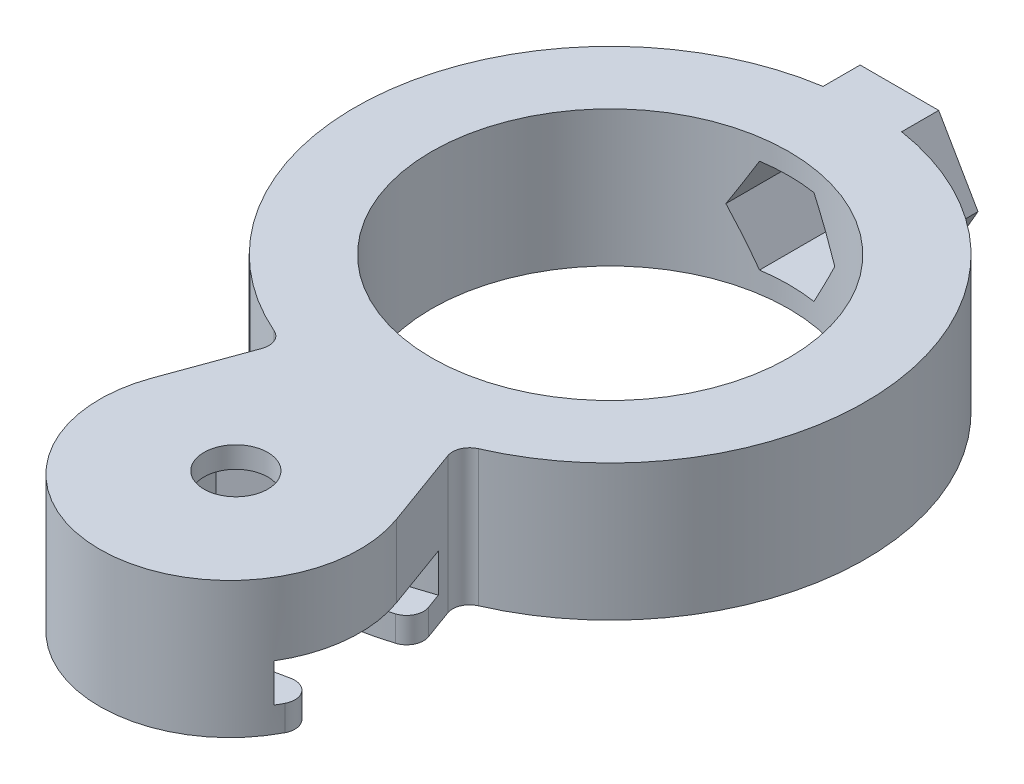
from build123d import *
from build123d.topology import SkipClean

# Parameters (mm, degrees)
CROQUIS1_R                          = 15
CROQUIS1_R_2                        = 10.5
SALIENTE_EXTRUIR1_DEPTH             = 4
CROQUIS2_R                          = 1.875
CORTAR_EXTRUIR1_DEPTH               = 8
SALIENTE_EXTRUIR2_REACH             = 35.779
SALIENTE_EXTRUIR2_END_RADIUS        = 15
CROQUIS2_4_R                        = 1.875
SALIENTE_EXTRUIR2_DIRECTION_2_DEPTH = 2
REVOLUCI_N1_ANGLE                   = 20
REVOLUCI_N1_OTHER_WAY_ANGLE         = 20
CORTAR_EXTRUIR6_DEPTH               = 35.481879299
CORTAR_EXTRUIR6_DEPTH_BACK          = 3
CROQUIS4_3_R                        = 1.875
CORTAR_EXTRUIR7_DEPTH               = 35.481879299
CORTAR_EXTRUIR8_START               = -8
CORTAR_EXTRUIR8_DEPTH               = 8
REDONDEO3_R                         = 1
SALIENTE_EXTRUIR3_START             = 5
SALIENTE_EXTRUIR3_DEPTH             = 5
CORTAR_EXTRUIR9_DEPTH               = 1.75
CORTAR_EXTRUIR9_DEPTH_BACK          = 0.5
SALIENTE_EXTRUIR4_OUTLINE_R         = 1.875
SALIENTE_EXTRUIR4_DEPTH             = 2.75
CORTAR_EXTRUIR10_DEPTH              = 3


# Read off the part's stored shape, not the designer's step: Cortar-Extruir8, Saliente-Extruir4
with BuildPart() as part:
    # Croquis1 → Saliente-Extruir1 (new, symmetric)
    with BuildSketch(Plane(origin=(0, 0, 0), x_dir=(1, 0, 0), z_dir=(0, 1, 0))):
        with Locations(Location((0, 0, 0), (0, 0, 270))):
            Circle(CROQUIS1_R)
        with Locations(Location((0, 0, 0), (0, 0, 270))):
            Circle(CROQUIS1_R_2, mode=Mode.SUBTRACT)
    extrude(amount=SALIENTE_EXTRUIR1_DEPTH, both=True)

    # Croquis2 → Cortar-Extruir1 (cut)
    with BuildSketch(Plane(origin=(0, 0, -15), x_dir=(-1, 0, 0), z_dir=(0, 0, -1))):
        Polygon((-3.2, 0), (-1.6, -2.771281292), (1.6, -2.771281292), (3.2, 0), (1.6, 2.771281292), (-1.6, 2.771281292), align=None)
        Circle(CROQUIS2_R)
    extrude(amount=-CORTAR_EXTRUIR1_DEPTH, mode=Mode.SUBTRACT)

    # Saliente-Extruir2: up to this cylinder (the profile starts outside it)
    with SkipClean():  # the faces are left unmerged after this step: merging them gives an invalid solid
        saliente_extruir2_end = Plane(origin=(0, -1.641104, 0), z_dir=(0, -1, 0)) * Cylinder(SALIENTE_EXTRUIR2_END_RADIUS, 103.15359, mode=Mode.PRIVATE)
        # Croquis2<4> → Saliente-Extruir2 (add, up to the surface)
        with BuildSketch(Plane(origin=(0, 0, -15), x_dir=(-1, 0, 0), z_dir=(0, 0, -1)), mode=Mode.PRIVATE) as saliente_extruir2_sk1:
            Polygon((-4.618802154, 0), (-2.309401077, -4), (2.309401077, -4), (4.618802154, 0), (2.309401077, 4), (-2.309401077, 4), align=None)
            Polygon((-1.6, -2.771281292), (1.6, -2.771281292), (3.2, 0), (1.6, 2.771281292), (-1.6, 2.771281292), (-3.2, 0), align=None, mode=Mode.SUBTRACT)
        saliente_extruir2_tool1 = extrude(saliente_extruir2_sk1.sketch, amount=-SALIENTE_EXTRUIR2_REACH, mode=Mode.PRIVATE) - saliente_extruir2_end
        add(saliente_extruir2_tool1.solids().sort_by_distance((3.358272, -1.938899, -15))[0])
        add(saliente_extruir2_tool1.solids().sort_by_distance((3.358272, -1.938899, -15))[1])
        # Croquis2<4> → Saliente-Extruir2 (add, up to the surface)
        with BuildSketch(Plane(origin=(0, 0, -15), x_dir=(-1, 0, 0), z_dir=(0, 0, -1)), mode=Mode.PRIVATE) as saliente_extruir2_sk2:
            Polygon((-3.2, 0), (-1.6, -2.771281292), (1.6, -2.771281292), (3.2, 0), (1.6, 2.771281292), (-1.6, 2.771281292), align=None)
            Circle(CROQUIS2_4_R, mode=Mode.SUBTRACT)
        saliente_extruir2_tool2 = extrude(saliente_extruir2_sk2.sketch, amount=-SALIENTE_EXTRUIR2_REACH, mode=Mode.PRIVATE) - saliente_extruir2_end
        add(saliente_extruir2_tool2.solids().sort_by_distance((2.326679, -1.343309, -15))[0])
        add(saliente_extruir2_tool2.solids().sort_by_distance((2.326679, -1.343309, -15))[1])

    # Croquis2<4> → Saliente-Extruir2 direction 2 (add)
    # profile 1 of 2: a face of its own
    with BuildSketch(Plane(origin=(0, 0, -15), x_dir=(-1, 0, 0), z_dir=(0, 0, -1))):
        Polygon((-4.618802154, 0), (-2.309401077, -4), (2.309401077, -4), (4.618802154, 0), (2.309401077, 4), (-2.309401077, 4), align=None)
        Polygon((-1.6, -2.771281292), (1.6, -2.771281292), (3.2, 0), (1.6, 2.771281292), (-1.6, 2.771281292), (-3.2, 0), align=None, mode=Mode.SUBTRACT)
    # profile 2 of 2: a face of its own
    with BuildSketch(Plane(origin=(0, 0, -15), x_dir=(-1, 0, 0), z_dir=(0, 0, -1))):
        Polygon((-3.2, 0), (-1.6, -2.771281292), (1.6, -2.771281292), (3.2, 0), (1.6, 2.771281292), (-1.6, 2.771281292), align=None)
        Circle(CROQUIS2_4_R, mode=Mode.SUBTRACT)
    extrude(amount=SALIENTE_EXTRUIR2_DIRECTION_2_DEPTH)

    # Croquis3 → Revolución1 (revolve)
    with BuildSketch(Plane(origin=(0, 0, 0), x_dir=(0, 0, -1), z_dir=(1, 0, 0))):
        Polygon((-30, 4), (-14, 4), (-14, -4), (-30, -4), (-30, -2.5), (-15, -2.5), (-15, 2.5), (-30, 2.5), align=None)
    revolve(axis=Axis((0, 4, 0), (0, -1, 0)), revolution_arc=REVOLUCI_N1_ANGLE)

    # Croquis3 → Revolución1 other way (revolve)
    with BuildSketch(Plane(origin=(0, 0, 0), x_dir=(0, 0, -1), z_dir=(1, 0, 0))):
        Polygon((-30, 4), (-14, 4), (-14, -4), (-30, -4), (-30, -2.5), (-15, -2.5), (-15, 2.5), (-30, 2.5), align=None)
    revolve(axis=Axis((0, 4, 0), (0, 1, 0)), revolution_arc=REVOLUCI_N1_OTHER_WAY_ANGLE)

    # Croquis4 → Cortar-Extruir6 (cut, two sides: drawn at the far end of the back side and taken through both)
    with BuildSketch(Plane.XZ.offset(4).offset(-CORTAR_EXTRUIR6_DEPTH_BACK)):
        with BuildLine():
            ThreePointArc((8.584705597, 23.586284782), (4.358569265, 24.7186746), (1.2e-08, 25.1))
            ThreePointArc((1.2e-08, 25.1), (-3.1, 22.000000006), (0, 18.9))
            ThreePointArc((0, 18.9), (3.281950558, 18.612866532), (6.464180709, 17.760190533))
            Line((6.464180709, 17.760190533), (8.584705597, 23.586284782))
        make_face()
    extrude(amount=CORTAR_EXTRUIR6_DEPTH + CORTAR_EXTRUIR6_DEPTH_BACK, mode=Mode.SUBTRACT)

    # Croquis4<3> → Cortar-Extruir7 (cut, through all)
    with BuildSketch(Plane.XZ.offset(4)):
        with Locations(Location((0, 22, 0), (0, 0, 270))):
            Circle(CROQUIS4_3_R)
    extrude(amount=-CORTAR_EXTRUIR7_DEPTH, mode=Mode.SUBTRACT)

    # Cortar-Extruir8 outline → Cortar-Extruir8 (cut)
    with BuildSketch(Plane.XZ.offset(4).offset(CORTAR_EXTRUIR8_START)):
        with BuildLine():
            ThreePointArc((-7.184552477, 19.7393957), (-6.262942497, 26.739718497), (1e-09, 30))
            ThreePointArc((1e-09, 30), (-5.20944533, 29.544232591), (-10.2606043, 28.190778624))
            Line((-10.2606043, 28.190778624), (-7.184552477, 19.7393957))
        make_face()
        with BuildLine():
            Line((7.184552477, 19.7393957), (8.584705598, 23.586284782))
            Line((8.584705598, 23.586284782), (10.2606043, 28.190778624))
            ThreePointArc((10.2606043, 28.190778624), (5.209445331, 29.54423259), (1e-09, 30))
            ThreePointArc((1e-09, 30), (6.262942498, 26.739718496), (7.184552477, 19.7393957))
        make_face()
    extrude(amount=CORTAR_EXTRUIR8_DEPTH, mode=Mode.SUBTRACT)

    # Redondeo3
    redondeo3_edges = [part.edges().sort_by_distance(p)[0] for p in [
        (6.464180709, -3.25, 17.760190533),
        (7.474898271, -3.25, 23.961133025),
        (-5.13030215, 3.25, 14.095389312),
        (-5.13030215, -3.25, 14.095389312),
        (5.13030215, 3.25, 14.095389312),
        (5.13030215, -3.25, 14.095389312),
    ]]
    fillet(redondeo3_edges, radius=REDONDEO3_R)

    # Croquis9 → Saliente-Extruir3 (add)
    with BuildSketch(Plane(origin=(0, -2.5, 0), x_dir=(1, 0, 0), z_dir=(0, 1, 0)).offset(SALIENTE_EXTRUIR3_START)):
        with BuildLine():
            Line((6.112599464, -16.794229002), (5.461623706, -15.005687805))
            ThreePointArc((5.461623706, -15.005687805), (5.482238333, -14.26959198), (6.001234056, -13.747188433))
            ThreePointArc((6.001234056, -13.747188433), (0, -15), (-6.001234056, -13.747188433))
            ThreePointArc((-6.001234056, -13.747188433), (-5.482238333, -14.26959198), (-5.461623706, -15.005687805))
            Line((-5.461623706, -15.005687805), (-7.184552477, -19.7393957))
            ThreePointArc((-7.184552477, -19.7393957), (-3.08103884, -29.351717504), (6.779967306, -25.888177056))
            ThreePointArc((6.779967306, -25.888177056), (6.683772805, -24.813619231), (5.667398999, -24.451801336))
            ThreePointArc((5.667398999, -24.451801336), (2.852173422, -24.93742382), (0, -25.1))
            ThreePointArc((0, -25.1), (-3.1, -22), (0, -18.9))
            ThreePointArc((0, -18.9), (2.760553354, -18.697308501), (5.461896053, -18.0935815))
            ThreePointArc((5.461896053, -18.0935815), (6.067051121, -17.584028122), (6.112599464, -16.794229002))
        make_face()
    extrude(amount=-SALIENTE_EXTRUIR3_DEPTH)

    # Croquis10 → Cortar-Extruir9 (cut, two sides: drawn at the far end of the back side and taken through both)
    with BuildSketch(Plane(origin=(0, -0.75, 0), x_dir=(-1, 0, 0), z_dir=(0, -1, 0)).offset(-CORTAR_EXTRUIR9_DEPTH_BACK)):
        with BuildLine():
            ThreePointArc((-6.779967306, -25.888177056), (-6.668671988, -26.09396334), (-6.551132513, -26.296248074))
            ThreePointArc((-6.551132513, -26.296248074), (-3.300127057, -26.898311497), (0, -27.1))
            ThreePointArc((0, -27.1), (5.1, -22), (0, -16.9))
            ThreePointArc((0, -16.9), (-1.942951583, -16.787940289), (-3.860136706, -16.453247236))
            ThreePointArc((-3.860136706, -16.453247236), (-4.828629021, -16.195503752), (-5.780140422, -15.880805291))
            Line((-5.780140422, -15.880805291), (-6.112599464, -16.794229002))
            ThreePointArc((-6.112599464, -16.794229002), (-6.067051121, -17.584028122), (-5.461896053, -18.0935815))
            ThreePointArc((-5.461896053, -18.0935815), (-2.760553354, -18.697308501), (0, -18.9))
            ThreePointArc((0, -18.9), (3.1, -22), (0, -25.1))
            ThreePointArc((0, -25.1), (-2.852173422, -24.93742382), (-5.667398999, -24.451801336))
            ThreePointArc((-5.667398999, -24.451801336), (-6.683772805, -24.813619231), (-6.779967306, -25.888177056))
        make_face()
    extrude(amount=CORTAR_EXTRUIR9_DEPTH + CORTAR_EXTRUIR9_DEPTH_BACK, mode=Mode.SUBTRACT)

    # Saliente-Extruir4 outline → Saliente-Extruir4 (add)
    with BuildSketch(Plane.XZ.offset(-2.5)):
        with BuildLine():
            ThreePointArc((5.461896053, 18.0935815), (6.067051121, 17.584028122), (6.112599464, 16.794229002))
            Line((6.112599464, 16.794229002), (7.184552477, 19.7393957))
            ThreePointArc((7.184552477, 19.7393957), (7.629143545, 22.856350834), (6.779967306, 25.888177056))
            ThreePointArc((6.779967306, 25.888177056), (6.683772805, 24.813619231), (5.667398999, 24.451801336))
            ThreePointArc((5.667398999, 24.451801336), (2.852173422, 24.93742382), (0, 25.1))
            ThreePointArc((0, 25.1), (-3.1, 22), (0, 18.9))
            ThreePointArc((0, 18.9), (2.760553354, 18.697308501), (5.461896053, 18.0935815))
        make_face()
        with Locations((0, 22)):
            Circle(SALIENTE_EXTRUIR4_OUTLINE_R, mode=Mode.SUBTRACT)
    extrude(amount=SALIENTE_EXTRUIR4_DEPTH)

    # Croquis12 → Cortar-Extruir10 (cut)
    with BuildSketch(Plane.XZ.offset(0.25)):
        Polygon((-2.771281292, 23.6), (-2.771281292, 20.4), (0, 18.8), (2.771281292, 20.4), (2.771281292, 23.6), (0, 25.2), align=None)
    extrude(amount=-CORTAR_EXTRUIR10_DEPTH, mode=Mode.SUBTRACT)


solid = part.part
